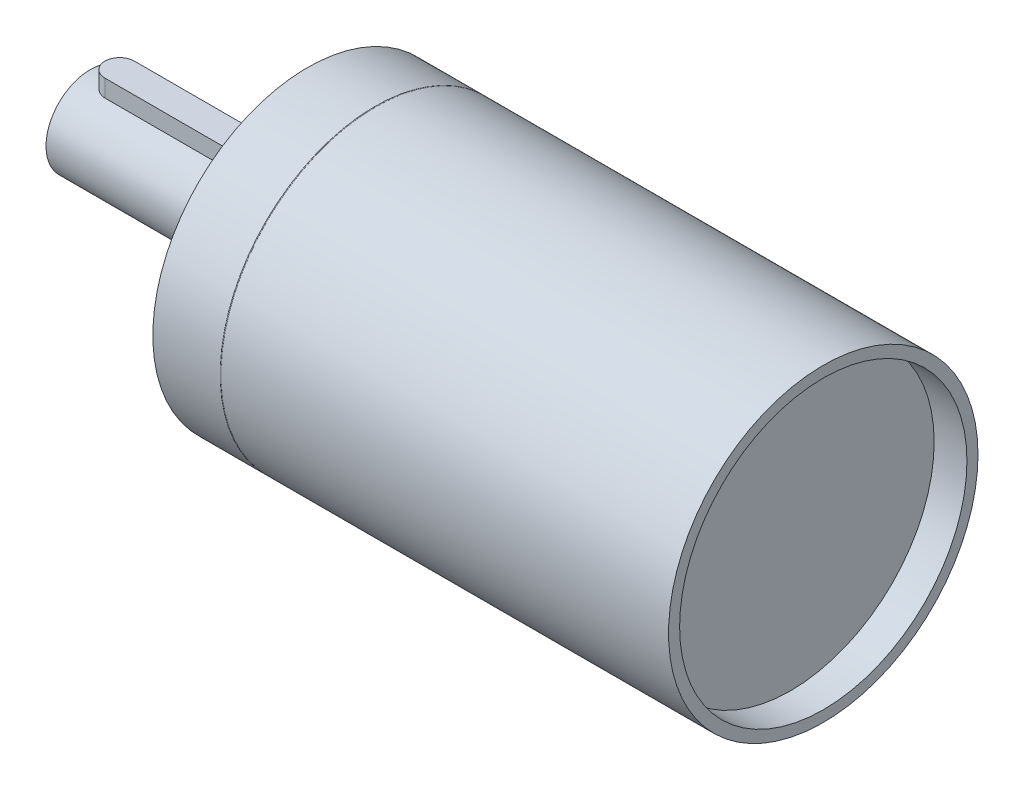
from build123d import *

# Parameters (mm, degrees)
SKETCH2_R           = 14
BOSS_EXTRUDE1_DEPTH = 3
SKETCH3_R           = 6
BOSS_EXTRUDE2_DEPTH = 26.5
BOSS_EXTRUDE3_DEPTH = 1
BOSS_EXTRUDE4_REACH = 80.626
HOLE1_D             = 39
HOLE1_DEPTH         = 4.45
HOLE2_D             = 3.3
HOLE2_DEPTH         = 6
HOLE2_TIP           = 0.991420021
HOLE3_D             = 3.3
HOLE3_DEPTH         = 6
HOLE3_TIP           = 0.991420021
HOLE4_D             = 3.3
HOLE4_DEPTH         = 6
HOLE4_TIP           = 0.991420021
HOLE5_D             = 3.3
HOLE5_DEPTH         = 6
HOLE5_TIP           = 0.991420021
HOLE6_D             = 1.25
HOLE6_DEPTH         = 1.939156082
HOLE6_CSINK_D       = 2.65
HOLE6_CSINK_ANGLE   = 60
HOLE6_TIP           = 0.360843918


with BuildPart() as part:
    # Sketch1 → Revolve1 (revolve)
    with BuildSketch(Plane.XY):
        with BuildLine():
            Line((0, 21), (0, 0))
            Line((0, 0), (70, 0))
            Line((70, 0), (70, 21))
            Line((70, 21), (9.25, 21))
            ThreePointArc((9.25, 21), (9.2, 20.98660254), (9.15, 21))
            Line((9.15, 21), (0, 21))
        make_face()
    revolve(axis=Axis((0, 0, 0), (1, 0, 0)))

    # Sketch2 → Boss-Extrude1 (add)
    with BuildSketch(Plane.ZY):
        Circle(SKETCH2_R)
    extrude(amount=BOSS_EXTRUDE1_DEPTH)

    # Sketch3 → Boss-Extrude2 (add)
    with BuildSketch(Plane.ZY.offset(3)):
        Circle(SKETCH3_R)
    extrude(amount=BOSS_EXTRUDE2_DEPTH)

    # Sketch4 → Boss-Extrude3 (add)
    with BuildSketch(Plane.ZY.offset(3)):
        with BuildLine():
            Line((0.293916284, -7.616838781), (0.293916284, -5.992796778))
            ThreePointArc((0.293916284, -5.992796778), (0, 6), (-0.293916284, -5.992796778))
            Line((-0.293916284, -5.992796778), (-0.293916284, -7.616838781))
            ThreePointArc((-0.293916284, -7.616838781), (-1.755912185, -7.072113956), (-2.882513969, -5.992796778))
            ThreePointArc((-2.882513969, -5.992796778), (0, 6.65), (2.882513969, -5.992796778))
            ThreePointArc((2.882513969, -5.992796778), (1.821852016, -7.17721696), (0.293916284, -7.616838781))
        make_face()
    extrude(amount=BOSS_EXTRUDE3_DEPTH)

    # Sketch5 → Boss-Extrude4 (add, up to next)
    with BuildSketch(Plane(origin=(0, 8, 0), x_dir=(-1, 0, 0), z_dir=(0, 1, 0)), mode=Mode.PRIVATE) as boss_extrude4_sk1:
        with BuildLine():
            Line((9.5, -2), (25.5, -2))
            ThreePointArc((25.5, -2), (27.5, 0), (25.5, 2))
            Line((25.5, 2), (9.5, 2))
            ThreePointArc((9.5, 2), (7.5, 0), (9.5, -2))
        make_face()
    boss_extrude4_tool1 = extrude(boss_extrude4_sk1.sketch, amount=-BOSS_EXTRUDE4_REACH, mode=Mode.PRIVATE) - part.part
    add(boss_extrude4_tool1.solids().sort_by_distance((-17.5, 8, 0))[0])

    # Hole1
    with Locations(Plane(origin=(70, 0, 0), x_dir=(0, 0, -1), z_dir=(1, 0, 0))):
        with Locations((0, 0)):
            Hole(HOLE1_D / 2, depth=HOLE1_DEPTH)

    # Hole2
    with Locations(Plane.ZY):
        with Locations((-17.5, 3.0543e-05)):
            Hole(HOLE2_D / 2, depth=HOLE2_DEPTH)
            with Locations((0, 0, -(HOLE2_DEPTH + HOLE2_TIP / 2))):  # 118° drill point
                Cone(0, HOLE2_D / 2, HOLE2_TIP, mode=Mode.SUBTRACT)

    # Hole3
    with Locations(Plane.ZY):
        with Locations((-3.0543e-05, -17.5)):
            Hole(HOLE3_D / 2, depth=HOLE3_DEPTH)
            with Locations((0, 0, -(HOLE3_DEPTH + HOLE3_TIP / 2))):  # 118° drill point
                Cone(0, HOLE3_D / 2, HOLE3_TIP, mode=Mode.SUBTRACT)

    # Hole4
    with Locations(Plane.ZY):
        with Locations((17.5, -3.0543e-05)):
            Hole(HOLE4_D / 2, depth=HOLE4_DEPTH)
            with Locations((0, 0, -(HOLE4_DEPTH + HOLE4_TIP / 2))):  # 118° drill point
                Cone(0, HOLE4_D / 2, HOLE4_TIP, mode=Mode.SUBTRACT)

    # Hole5
    with Locations(Plane.ZY):
        with Locations((3.0543e-05, 17.5)):
            Hole(HOLE5_D / 2, depth=HOLE5_DEPTH)
            with Locations((0, 0, -(HOLE5_DEPTH + HOLE5_TIP / 2))):  # 118° drill point
                Cone(0, HOLE5_D / 2, HOLE5_TIP, mode=Mode.SUBTRACT)

    # Hole6
    with Locations(Plane.ZY.offset(29.5)):
        with Locations((0, 0)):
            CounterSinkHole(HOLE6_D / 2, HOLE6_CSINK_D / 2, depth=HOLE6_DEPTH, counter_sink_angle=HOLE6_CSINK_ANGLE)
            with Locations((0, 0, -(HOLE6_DEPTH + HOLE6_TIP / 2))):  # 120° drill point
                Cone(0, HOLE6_D / 2, HOLE6_TIP, mode=Mode.SUBTRACT)


solid = part.part
